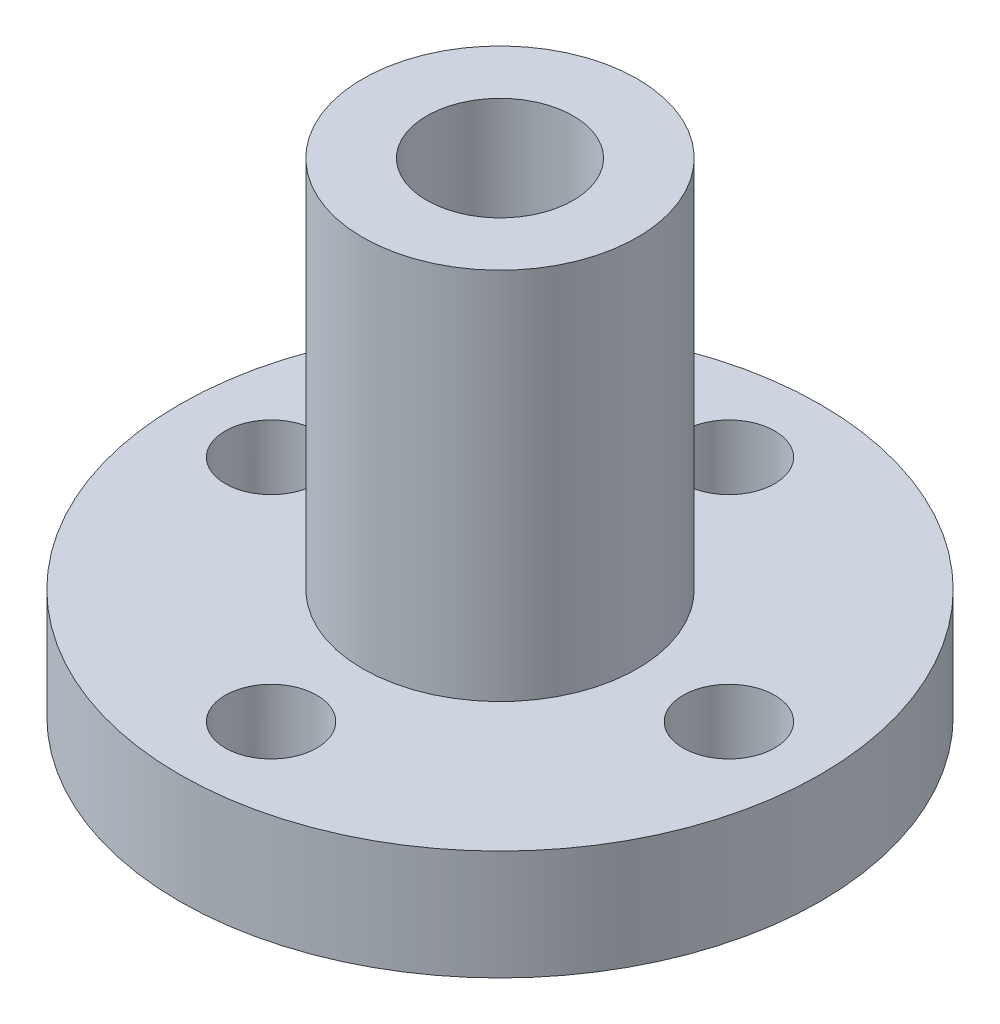
from build123d import *

# Parameters (mm, degrees)
SKETCH_1_R               = 17.5
EXTRUDE_1_DEPTH          = 6
SKETCH_3_R               = 7.5
EXTRUDE_2_DEPTH          = 20.4
SKETCH_4_R               = 4
CUT_EXTRUDE_1_DEPTH      = 37.186461557
SKETCH_5_R               = 2.5
CUT_EXTRUDE_2_DEPTH      = 10
PATTERN_CIRCULAR_1_COUNT = 4


with BuildPart() as part:
    # 草图1 → 凸台-拉伸1 (new body)
    with BuildSketch(Plane(origin=(0, 0, 0), x_dir=(1, 0, 0), z_dir=(0, 1, 0))):
        Circle(SKETCH_1_R)
    extrude(amount=EXTRUDE_1_DEPTH)

    # 草图3 → 凸台-拉伸2 (add)
    with BuildSketch(Plane(origin=(0, 6, 0), x_dir=(1, 0, 0), z_dir=(0, 1, 0))):
        Circle(SKETCH_3_R)
    extrude(amount=EXTRUDE_2_DEPTH)

    # 草图4 → 切除-拉伸1 (cut, through all)
    with BuildSketch(Plane(origin=(0, 26.4, 0), x_dir=(1, 0, 0), z_dir=(0, 1, 0))):
        Circle(SKETCH_4_R)
    extrude(amount=-CUT_EXTRUDE_1_DEPTH, mode=Mode.SUBTRACT)

    # 草图5 → 切除-拉伸2 (cut)
    with BuildSketch(Plane(origin=(0, 6, 0), x_dir=(1, 0, 0), z_dir=(0, 1, 0))):
        with Locations((0, 12.5)):
            Circle(SKETCH_5_R)
    cut_extrude_2 = extrude(amount=-CUT_EXTRUDE_2_DEPTH, mode=Mode.SUBTRACT)

    # 阵列(圆周)1: 切除-拉伸2 ×4 about axis
    pattern_circular_1_axis = Axis((0, 6, 0), (0, 1, 0))
    for i in range(1, PATTERN_CIRCULAR_1_COUNT):
        add(cut_extrude_2.rotate(pattern_circular_1_axis, i * 360 / PATTERN_CIRCULAR_1_COUNT), mode=Mode.SUBTRACT)


solid = part.part
